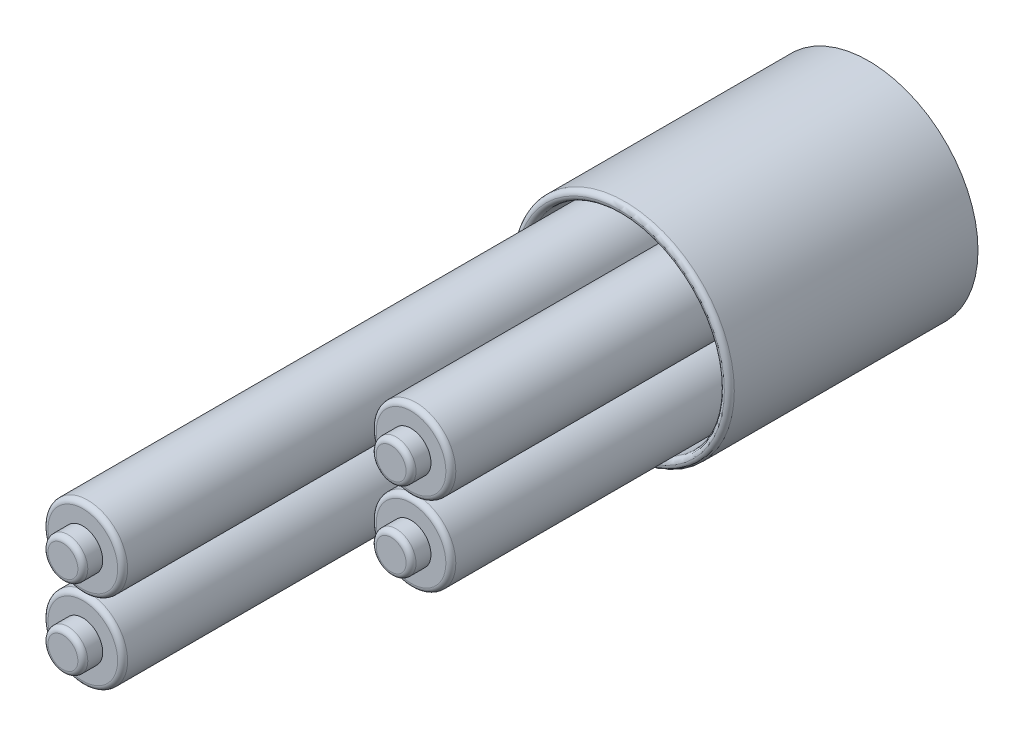
from build123d import *

# Parameters (mm, degrees)
SKETCH1_R            = 0.1016
SKETCH1_R_2          = 0.0508
BOSS_EXTRUDE4_DEPTH  = 1.905
SKETCH1_12_R         = 0.1016
SKETCH1_12_R_2       = 0.0508
BOSS_EXTRUDE9_DEPTH  = 1.27
SKETCH1_13_R         = 0.1016
SKETCH1_13_R_2       = 0.0508
BOSS_EXTRUDE10_DEPTH = 1.27
SKETCH1_14_R         = 0.2794
SKETCH1_14_R_2       = 0.254
BOSS_EXTRUDE11_DEPTH = 0.635
SKETCH1_15_R         = 0.1016
SKETCH1_15_R_2       = 0.0508
BOSS_EXTRUDE12_DEPTH = 1.905
SKETCH1_17_R         = 0.0508
BOSS_EXTRUDE14_DEPTH = 1.3208
FILLET2_R            = 0.0127
FILLET5_R            = 0.0127
SKETCH1_18_R         = 0.0508
BOSS_EXTRUDE15_DEPTH = 1.3208
FILLET6_R            = 0.0127
SKETCH1_20_R         = 0.0508
BOSS_EXTRUDE17_DEPTH = 1.9558
FILLET7_R            = 0.0127
SKETCH1_22_R         = 0.0508
BOSS_EXTRUDE19_DEPTH = 1.9558
FILLET8_R            = 0.0127
FILLET9_R            = 0.0127
FILLET10_R           = 0.0127
FILLET11_R           = 0.0127
FILLET12_R           = 0.0127


with BuildPart() as part:
    # Sketch1 → Boss-Extrude4 (new body)
    with BuildSketch(Plane.XY):
        with Locations((-0.1016, -0.1016)):
            Circle(SKETCH1_R)
        with Locations((-0.1016, -0.1016)):
            Circle(SKETCH1_R_2, mode=Mode.SUBTRACT)
    extrude(amount=BOSS_EXTRUDE4_DEPTH)

    # Fillet9
    fillet9_edges = [part.edges().sort_by_distance(p)[0] for p in [
        (-0.2032, -0.1016, 1.905),
    ]]
    fillet(fillet9_edges, radius=FILLET9_R)


with BuildPart() as body_2:
    # Sketch1<12> → Boss-Extrude9 (new body)
    with BuildSketch(Plane.XY):
        with Locations((0.1016, 0.1016)):
            Circle(SKETCH1_12_R)
        with Locations((0.1016, 0.1016)):
            Circle(SKETCH1_12_R_2, mode=Mode.SUBTRACT)
    extrude(amount=BOSS_EXTRUDE9_DEPTH)

    # Fillet11
    fillet11_edges = [body_2.edges().sort_by_distance(p)[0] for p in [
        (0, 0.1016, 1.27),
    ]]
    fillet(fillet11_edges, radius=FILLET11_R)


with BuildPart() as body_3:
    # Sketch1<13> → Boss-Extrude10 (new body)
    with BuildSketch(Plane.XY):
        with Locations((0.1016, -0.1016)):
            Circle(SKETCH1_13_R)
        with Locations((0.1016, -0.1016)):
            Circle(SKETCH1_13_R_2, mode=Mode.SUBTRACT)
    extrude(amount=BOSS_EXTRUDE10_DEPTH)

    # Fillet10
    fillet10_edges = [body_3.edges().sort_by_distance(p)[0] for p in [
        (0, -0.1016, 1.27),
    ]]
    fillet(fillet10_edges, radius=FILLET10_R)


with BuildPart() as body_4:
    # Sketch1<14> → Boss-Extrude11 (new body)
    with BuildSketch(Plane.XY):
        Circle(SKETCH1_14_R)
        Circle(SKETCH1_14_R_2, mode=Mode.SUBTRACT)
    extrude(amount=BOSS_EXTRUDE11_DEPTH)

    # Fillet5
    fillet5_edges = [body_4.edges().sort_by_distance(p)[0] for p in [
        (-0.2794, 0, 0.635),
        (-0.254, 0, 0.635),
    ]]
    fillet(fillet5_edges, radius=FILLET5_R - 0.0001)  # a hair under: the kernel refuses the full size


with BuildPart() as body_5:
    # Sketch1<15> → Boss-Extrude12 (new body)
    with BuildSketch(Plane.XY):
        with Locations((-0.1016, 0.1016)):
            Circle(SKETCH1_15_R)
        with Locations((-0.1016, 0.1016)):
            Circle(SKETCH1_15_R_2, mode=Mode.SUBTRACT)
    extrude(amount=BOSS_EXTRUDE12_DEPTH)

    # Fillet12
    fillet12_edges = [body_5.edges().sort_by_distance(p)[0] for p in [
        (-0.2032, 0.1016, 1.905),
    ]]
    fillet(fillet12_edges, radius=FILLET12_R)


with BuildPart() as body_6:
    # Sketch1<17> → Boss-Extrude14 (new body)
    with BuildSketch(Plane.XY):
        with Locations((0.1016, 0.1016)):
            Circle(SKETCH1_17_R)
    extrude(amount=BOSS_EXTRUDE14_DEPTH)

    # Fillet2
    fillet2_edges = [body_6.edges().sort_by_distance(p)[0] for p in [
        (0.0508, 0.1016, 1.3208),
    ]]
    fillet(fillet2_edges, radius=FILLET2_R)


with BuildPart() as body_7:
    # Sketch1<18> → Boss-Extrude15 (new body)
    with BuildSketch(Plane.XY):
        with Locations((0.1016, -0.1016)):
            Circle(SKETCH1_18_R)
    extrude(amount=BOSS_EXTRUDE15_DEPTH)

    # Fillet6
    fillet6_edges = [body_7.edges().sort_by_distance(p)[0] for p in [
        (0.0508, -0.1016, 1.3208),
    ]]
    fillet(fillet6_edges, radius=FILLET6_R)


with BuildPart() as body_8:
    # Sketch1<20> → Boss-Extrude17 (new body)
    with BuildSketch(Plane.XY):
        with Locations((-0.1016, -0.1016)):
            Circle(SKETCH1_20_R)
    extrude(amount=BOSS_EXTRUDE17_DEPTH)

    # Fillet7
    fillet7_edges = [body_8.edges().sort_by_distance(p)[0] for p in [
        (-0.1524, -0.1016, 1.9558),
    ]]
    fillet(fillet7_edges, radius=FILLET7_R)


with BuildPart() as body_9:
    # Sketch1<22> → Boss-Extrude19 (new body)
    with BuildSketch(Plane.XY):
        with Locations((-0.1016, 0.1016)):
            Circle(SKETCH1_22_R)
    extrude(amount=BOSS_EXTRUDE19_DEPTH)

    # Fillet8
    fillet8_edges = [body_9.edges().sort_by_distance(p)[0] for p in [
        (-0.1524, 0.1016, 1.9558),
    ]]
    fillet(fillet8_edges, radius=FILLET8_R)


solid = Compound([part.part, body_2.part, body_3.part, body_4.part, body_5.part, body_6.part, body_7.part, body_8.part, body_9.part])
